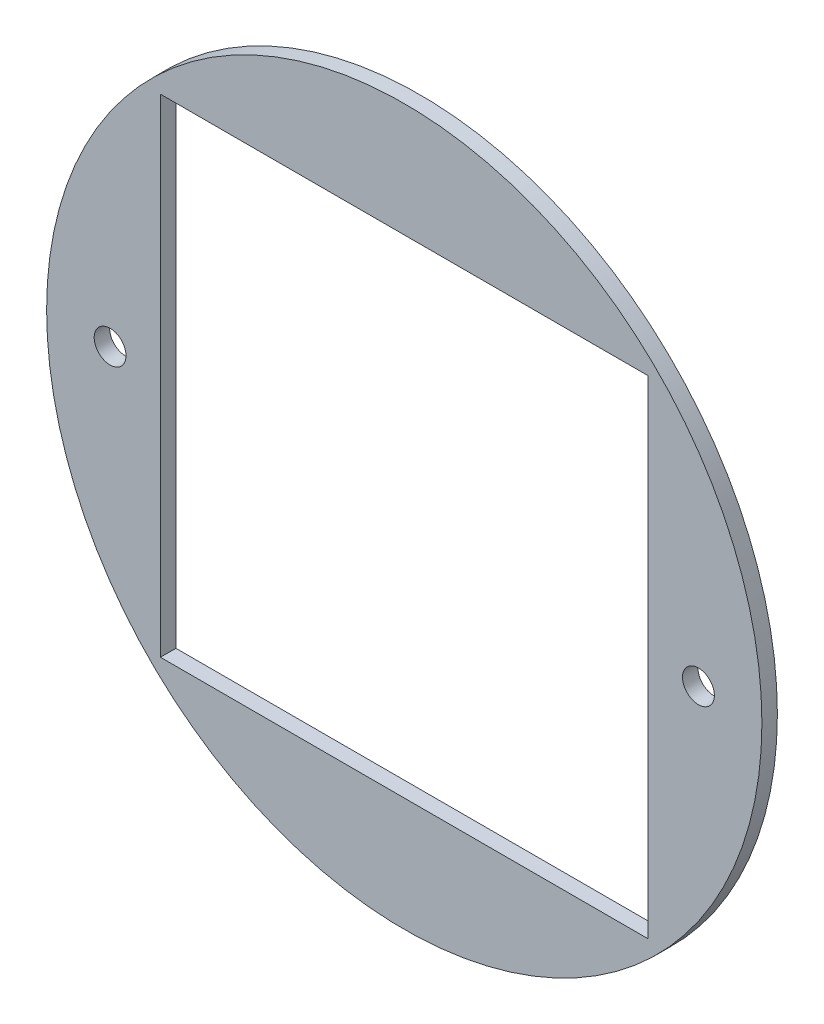
from build123d import *

# Parameters (mm, degrees)
SKETCH1_R               = 73.3425
BOSS_EXTRUDE1_DEPTH     = 3.175
F_1_4_CLEARANCE_HOLE1_D = 6.5278
CUT_EXTRUDE1_DEPTH      = 104.77054128
CUT_EXTRUDE1_DEPTH_BACK = 104.77054128
SKETCH4_W               = 99.999999898
SKETCH4_H               = 99.999999898


with BuildPart() as part:
    # Sketch1 → Boss-Extrude1 (new body)
    with BuildSketch(Plane.XY):
        Circle(SKETCH1_R)
    extrude(amount=BOSS_EXTRUDE1_DEPTH)

    # 1/4 Clearance Hole1 (through all)
    with Locations(Plane.XY.offset(3.175)):
        with Locations((-60.325, 0), (60.325, 0)):
            Hole(F_1_4_CLEARANCE_HOLE1_D / 2)

    # Sketch4 → Cut-Extrude1 (cut, two sides: drawn at the far end of the back side and taken through both)
    with BuildSketch(Plane.XY.offset(3.175).offset(-CUT_EXTRUDE1_DEPTH_BACK)):
        Rectangle(SKETCH4_W, SKETCH4_H)
    extrude(amount=CUT_EXTRUDE1_DEPTH + CUT_EXTRUDE1_DEPTH_BACK, mode=Mode.SUBTRACT)


solid = part.part
